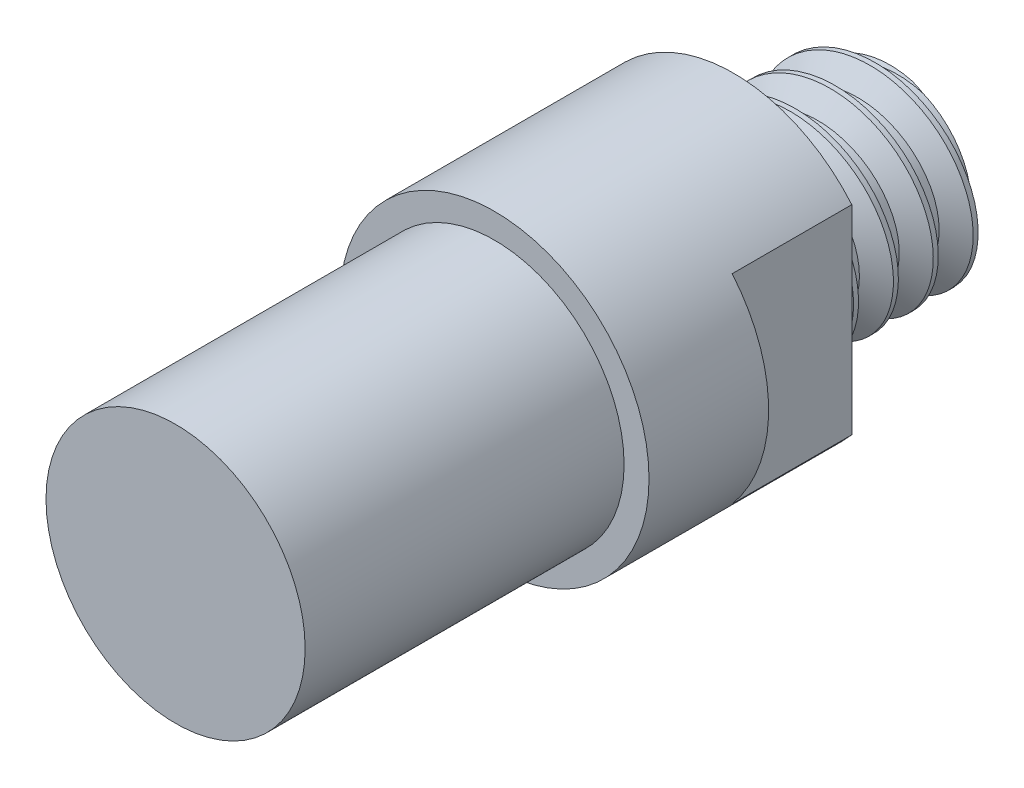
from build123d import *

# Parameters (mm, degrees)
SKETCH1_R           = 5
BOSS_EXTRUDE1_DEPTH = 8
THREAD1_PITCH       = 2
SKETCH4_OUTSIDE_W   = 49.89
SKETCH4_OUTSIDE_H   = 49.89
SKETCH4_OUTSIDE_R   = 4
CUT_EXTRUDE1_DEPTH  = 10
CUT_EXTRUDE1_DRAFT  = -60
SKETCH5_R           = 7.75
BOSS_EXTRUDE2_DEPTH = 12
SKETCH6_R           = 6.5
BOSS_EXTRUDE3_DEPTH = 16
CUT_EXTRUDE2_DEPTH  = 6


with BuildPart() as part:
    # Sketch1 → Boss-Extrude1 (new body)
    with BuildSketch(Plane(origin=(0, 0, 0), x_dir=(0, 1, 0), z_dir=(0, 0, 1))):
        with Locations(Location((0, 0, 0), (0, 0, 270))):
            Circle(SKETCH1_R)
    extrude(amount=BOSS_EXTRUDE1_DEPTH)

    # Thread1: the profile of Thread Profile1 profile screwed along a right-hand helix of 6.5 turns, 10 arcs to a turn; built about Z, then put on its axis
    thread1_z = Axis((0, 0, 0), (0, 0, 1))
    thread1_corners = [(5.0003, 0, -0.000173205), (5.0003, 0, 1.7501732), (3.91746825, 0, 1.124999997), (3.91746825, 0, 0.624999997)]
    with BuildLine(mode=Mode.PRIVATE) as thread1_profile:
        Line(thread1_corners[0], thread1_corners[1])
        Line(thread1_corners[1], thread1_corners[2])
        Line(thread1_corners[2], thread1_corners[3])
        Line(thread1_corners[3], thread1_corners[0])
    thread1_cap = Face(thread1_profile.wire())
    thread1_turn_angles = [0, 18, 36, 54, 72, 90, 108, 126, 144, 162, 180, 198, 216, 234, 252, 270, 288, 306, 324, 342, 360]
    thread1_turn_weights = [1, 0.9510565162951535, 1, 0.9510565162951535, 1, 0.9510565162951535, 1, 0.9510565162951535, 1, 0.9510565162951535, 1, 0.9510565162951535, 1, 0.9510565162951535, 1, 0.9510565162951535, 1, 0.9510565162951535, 1, 0.9510565162951535, 1]
    thread1_turn_rails = [Edge.make_bspline([Vector(p[0], p[1], 0).rotate(thread1_z, thread1_turn_angles[k]) / thread1_turn_weights[k] + Vector(0, 0, p[2] + THREAD1_PITCH * thread1_turn_angles[k] / 360) for k in range(21)], [0, 0, 0, 1, 1, 2, 2, 3, 3, 4, 4, 5, 5, 6, 6, 7, 7, 8, 8, 9, 9, 10, 10, 10], 2, thread1_turn_weights) for p in thread1_corners]
    thread1_turn_sides = [Face.make_surface_from_curves(thread1_turn_rails[p[0]], thread1_turn_rails[p[1]]) for p in [(0, 1), (1, 2), (2, 3), (3, 0)]]
    thread1_last_angles = [2160, 2178, 2196, 2214, 2232, 2250, 2268, 2286, 2304, 2322, 2340]
    thread1_last_weights = [1, 0.9510565162951535, 1, 0.9510565162951535, 1, 0.9510565162951535, 1, 0.9510565162951535, 1, 0.9510565162951535, 1]
    thread1_last_rails = [Edge.make_bspline([Vector(p[0], p[1], 0).rotate(thread1_z, thread1_last_angles[k]) / thread1_last_weights[k] + Vector(0, 0, p[2] + THREAD1_PITCH * thread1_last_angles[k] / 360) for k in range(11)], [0, 0, 0, 1, 1, 2, 2, 3, 3, 4, 4, 5, 5, 5], 2, thread1_last_weights) for p in thread1_corners]
    thread1_last_sides = [Face.make_surface_from_curves(thread1_last_rails[p[0]], thread1_last_rails[p[1]]) for p in [(0, 1), (1, 2), (2, 3), (3, 0)]]
    thread1 = Plane(origin=(0, 0, -3), x_dir=(1, 0, 0), z_dir=(0, 0, 1)) * Solid(Shell([*[p.moved(Location((0, 0, THREAD1_PITCH * i))) for i in range(6) for p in thread1_turn_sides], *thread1_last_sides, thread1_cap, thread1_cap.rotate(thread1_z, 2340).moved(Location((0, 0, THREAD1_PITCH * 2340 / 360)))]))
    add(thread1, mode=Mode.SUBTRACT)


with BuildPart() as cut_extrude1_tool:
    # Sketch4 outside → Cut-Extrude1 (with draft: the straight prism first)
    with BuildSketch(Plane(origin=(0, 0, 0), x_dir=(1, 0, 0), z_dir=(0, 0, -1))):
        Rectangle(SKETCH4_OUTSIDE_W, SKETCH4_OUTSIDE_H)
        Circle(SKETCH4_OUTSIDE_R, mode=Mode.SUBTRACT)
    extrude(amount=-CUT_EXTRUDE1_DEPTH)
    # Cut-Extrude1: the draft: its side faces are tilted about the plane it starts from
    cut_extrude1_sides = [cut_extrude1_tool.faces().sort_by_distance(p)[0] for p in [
        (0, 24.945, 5),
        (24.945, 0, 5),
        (0, -24.945, 5),
        (-24.945, 0, 5),
        (-4, 0, 5),
    ]]
    draft(cut_extrude1_sides, Plane(origin=(0, 0, 0), x_dir=(1, 0, 0), z_dir=(0, 0, -1)), CUT_EXTRUDE1_DRAFT)


with BuildPart() as part_1:
    add(part.part)

    # Cut-Extrude1: cut by cut_extrude1_tool
    add(cut_extrude1_tool.part, mode=Mode.SUBTRACT)

    # Sketch5 → Boss-Extrude2 (add)
    with BuildSketch(Plane.XY.offset(8)):
        Circle(SKETCH5_R)
    extrude(amount=BOSS_EXTRUDE2_DEPTH)

    # Sketch6 → Boss-Extrude3 (add)
    with BuildSketch(Plane.XY.offset(20)):
        Circle(SKETCH6_R)
    extrude(amount=BOSS_EXTRUDE3_DEPTH)

    # Sketch7 → Cut-Extrude2 (cut)
    with BuildSketch(Plane(origin=(0, 0, 8), x_dir=(1, 0, 0), z_dir=(0, 0, -1))):
        with BuildLine():
            Line((-5.921359641, -5), (-5.921359641, 5))
            ThreePointArc((-5.921359641, 5), (-7.75, 0), (-5.921359641, -5))
        make_face()
        with BuildLine():
            Line((5.921359641, -5), (5.921359641, 5))
            ThreePointArc((5.921359641, 5), (7.75, 0), (5.921359641, -5))
        make_face()
    extrude(amount=-CUT_EXTRUDE2_DEPTH, mode=Mode.SUBTRACT)


solid = part_1.part
